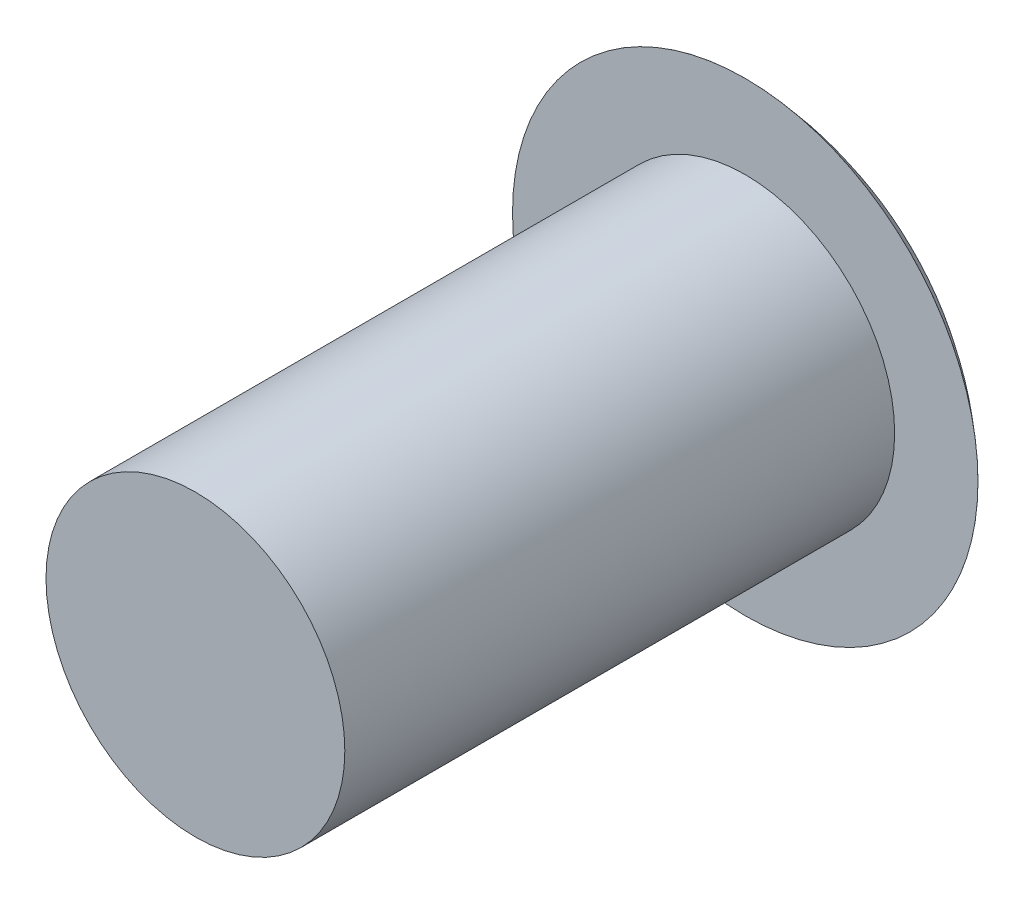
from build123d import *

# Parameters (mm, degrees)
SKETCH1_R           = 5
BOSS_EXTRUDE1_DEPTH = 9.2
SKETCH2_R           = 7.788167924
BOSS_EXTRUDE2_DEPTH = 0.001
DOME1_FACE_RADIUS   = 7.788167924
DOME1_HEIGHT        = 3
CUT_EXTRUDE1_START  = -10
CUT_EXTRUDE1_DEPTH  = 40
CHAMFER2_SIZE       = 0.16446068
SCALE1_SCALE        = 1.9329
SCALE2_SCALE        = 1.5


with BuildPart() as part:
    # Sketch1 → Boss-Extrude1 (new, symmetric)
    with BuildSketch(Plane.XY):
        Circle(SKETCH1_R)
    extrude(amount=BOSS_EXTRUDE1_DEPTH, both=True)

    # Sketch2 → Boss-Extrude2 (add)
    with BuildSketch(Plane(origin=(0, 0, -9.2), x_dir=(-1, 0, 0), z_dir=(0, 0, -1))):
        Circle(SKETCH2_R)
    extrude(amount=BOSS_EXTRUDE2_DEPTH)

    # Dome1: a dome of height H over a round flat face of radius A is a cap of a sphere of radius (A * A + H * H) / (2 * H)
    dome1_r = (DOME1_FACE_RADIUS * DOME1_FACE_RADIUS + DOME1_HEIGHT * DOME1_HEIGHT) / (2 * DOME1_HEIGHT)
    dome1_base = Plane((0, 0, -9.201), z_dir=(0, 0, -1))
    with Locations(dome1_base.offset(DOME1_HEIGHT - dome1_r)):
        dome1_ball = Sphere(dome1_r, mode=Mode.PRIVATE)
    add(split(dome1_ball, bisect_by=dome1_base, keep=Keep.TOP, mode=Mode.PRIVATE))

    # Sketch3 → Cut-Extrude1 (cut)
    with BuildSketch(Plane.XY.offset(CUT_EXTRUDE1_START)):
        Polygon((-3.312540498, 0), (-1.656270249, -2.868744223), (1.656270249, -2.868744223), (3.312540498, 0), (1.656270249, 2.868744223), (-1.656270249, 2.868744223), align=None)
    extrude(amount=-CUT_EXTRUDE1_DEPTH, mode=Mode.SUBTRACT)

    # Chamfer2
    # the kernel refuses this chamfer: 0.2, 0.16446068 mm, written as the material it takes off along each edge
    with BuildSketch(Plane(origin=(-2.484405374, -1.434372111, -0.591740065), x_dir=(-0.09595536386249687, 0.16619956546860265, -0.9814123866061929), z_dir=(-0.49070619330309756, 0.8499280583896772, 0.1919107277249933))) as chamfer2_piece_1_section:
        with BuildLine():
            Line((11.198587704, 0.191737716), (11.2492321 - CHAMFER2_SIZE, 0))
            Line((11.2492321 - CHAMFER2_SIZE, 0), (11.2492321, 0))
            ThreePointArc((11.2492321, 0), (11.223603032, 0.098687532), (11.198587704, 0.191737716))
        make_face()
    chamfer2_piece_1 = revolve(axis=Axis((-2.484405374, -1.434372111, -0.591740065), (-0.866025403784438, -0.5000000000000011, 0)), revolution_arc=22.128626255, mode=Mode.PRIVATE)
    chamfer2_piece_1 = split(chamfer2_piece_1, bisect_by=Plane(origin=(-3.726608061, -0.717186056, -0.591740065), z_dir=(0.8660254037844416, -0.499999999999995, 0)), keep=Keep.TOP, mode=Mode.PRIVATE)
    chamfer2_piece_1 = split(chamfer2_piece_1, bisect_by=Plane(origin=(-2.484405374, -2.868744223, -0.591740065), z_dir=(0, 1, 0)), keep=Keep.TOP, mode=Mode.PRIVATE)
    add(chamfer2_piece_1, mode=Mode.SUBTRACT)
    with BuildSketch(Plane(origin=(0, -2.868744223, -0.591740065), x_dir=(-0.1919107277249941, 0, -0.9814123866061928), z_dir=(-0.9814123866061928, -3.420849025073354e-15, 0.1919107277249941))) as chamfer2_piece_2_section:
        with BuildLine():
            Line((11.198587704, 0.191737716), (11.2492321 - CHAMFER2_SIZE, 0))
            Line((11.2492321 - CHAMFER2_SIZE, 0), (11.2492321, 0))
            ThreePointArc((11.2492321, 0), (11.223603032, 0.098687532), (11.198587704, 0.191737716))
        make_face()
    chamfer2_piece_2 = revolve(axis=Axis((0, -2.868744223, -0.591740065), (0, -1, 0)), revolution_arc=22.128626255, mode=Mode.PRIVATE)
    chamfer2_piece_2 = split(chamfer2_piece_2, bisect_by=Plane(origin=(1.242202687, -3.585930278, -0.591740065), z_dir=(-0.8660254037844415, 0.49999999999999506, 0)), keep=Keep.TOP, mode=Mode.PRIVATE)
    chamfer2_piece_2 = split(chamfer2_piece_2, bisect_by=Plane(origin=(-1.242202687, -3.585930278, -0.591740065), z_dir=(0.866025403784438, 0.5000000000000011, 0)), keep=Keep.TOP, mode=Mode.PRIVATE)
    add(chamfer2_piece_2, mode=Mode.SUBTRACT)
    with BuildSketch(Plane(origin=(2.484405374, -1.434372111, -0.591740065), x_dir=(-0.09595536386249569, -0.16619956546860332, -0.9814123866061929), z_dir=(-0.4907061933030916, -0.8499280583896806, 0.1919107277249933))) as chamfer2_piece_3_section:
        with BuildLine():
            Line((11.198587704, 0.191737716), (11.2492321 - CHAMFER2_SIZE, 0))
            Line((11.2492321 - CHAMFER2_SIZE, 0), (11.2492321, 0))
            ThreePointArc((11.2492321, 0), (11.223603032, 0.098687532), (11.198587704, 0.191737716))
        make_face()
    chamfer2_piece_3 = revolve(axis=Axis((2.484405374, -1.434372111, -0.591740065), (0.8660254037844415, -0.49999999999999506, 0)), revolution_arc=22.128626255, mode=Mode.PRIVATE)
    chamfer2_piece_3 = split(chamfer2_piece_3, bisect_by=Plane(origin=(3.726608061, -0.717186056, -0.591740065), z_dir=(-0.8660254037844346, -0.5000000000000072, 0)), keep=Keep.TOP, mode=Mode.PRIVATE)
    chamfer2_piece_3 = split(chamfer2_piece_3, bisect_by=Plane(origin=(2.484405374, -2.868744223, -0.591740065), z_dir=(0, 1, 0)), keep=Keep.TOP, mode=Mode.PRIVATE)
    add(chamfer2_piece_3, mode=Mode.SUBTRACT)
    with BuildSketch(Plane(origin=(2.484405374, 1.434372111, -0.591740065), x_dir=(0.09595536386249802, -0.16619956546860198, -0.9814123866061929), z_dir=(0.49070619330310355, -0.8499280583896739, 0.19191072772499332))) as chamfer2_piece_4_section:
        with BuildLine():
            Line((11.198587704, 0.191737716), (11.2492321 - CHAMFER2_SIZE, 0))
            Line((11.2492321 - CHAMFER2_SIZE, 0), (11.2492321, 0))
            ThreePointArc((11.2492321, 0), (11.223603032, 0.098687532), (11.198587704, 0.191737716))
        make_face()
    chamfer2_piece_4 = revolve(axis=Axis((2.484405374, 1.434372111, -0.591740065), (0.8660254037844346, 0.5000000000000072, 0)), revolution_arc=22.128626255, mode=Mode.PRIVATE)
    chamfer2_piece_4 = split(chamfer2_piece_4, bisect_by=Plane(origin=(2.484405374, 2.868744223, -0.591740065), z_dir=(0, -1, 0)), keep=Keep.TOP, mode=Mode.PRIVATE)
    chamfer2_piece_4 = split(chamfer2_piece_4, bisect_by=Plane(origin=(3.726608061, 0.717186056, -0.591740065), z_dir=(-0.8660254037844415, 0.49999999999999506, 0)), keep=Keep.TOP, mode=Mode.PRIVATE)
    add(chamfer2_piece_4, mode=Mode.SUBTRACT)
    with BuildSketch(Plane(origin=(0, 2.868744223, -0.591740065), x_dir=(0.1919107277249941, 1.9738645532128006e-15, -0.9814123866061928), z_dir=(0.9814123866061928, 1.0130975958871086e-14, 0.1919107277249941))) as chamfer2_piece_5_section:
        with BuildLine():
            Line((11.198587704, 0.191737716), (11.2492321 - CHAMFER2_SIZE, 0))
            Line((11.2492321 - CHAMFER2_SIZE, 0), (11.2492321, 0))
            ThreePointArc((11.2492321, 0), (11.223603032, 0.098687532), (11.198587704, 0.191737716))
        make_face()
    chamfer2_piece_5 = revolve(axis=Axis((0, 2.868744223, -0.591740065), (0, 1, 0)), revolution_arc=22.128626255, mode=Mode.PRIVATE)
    chamfer2_piece_5 = split(chamfer2_piece_5, bisect_by=Plane(origin=(-1.242202687, 3.585930278, -0.591740065), z_dir=(0.8660254037844416, -0.499999999999995, 0)), keep=Keep.TOP, mode=Mode.PRIVATE)
    chamfer2_piece_5 = split(chamfer2_piece_5, bisect_by=Plane(origin=(1.242202687, 3.585930278, -0.591740065), z_dir=(-0.8660254037844346, -0.5000000000000072, 0)), keep=Keep.TOP, mode=Mode.PRIVATE)
    add(chamfer2_piece_5, mode=Mode.SUBTRACT)
    with BuildSketch(Plane(origin=(-2.484405374, 1.434372111, -0.591740065), x_dir=(0.09595536386249523, 0.16619956546860257, -0.981412386606193), z_dir=(0.4907061933030916, 0.8499280583896808, 0.1919107277249924))) as chamfer2_piece_6_section:
        with BuildLine():
            Line((11.198587704, 0.191737716), (11.2492321 - CHAMFER2_SIZE, 0))
            Line((11.2492321 - CHAMFER2_SIZE, 0), (11.2492321, 0))
            ThreePointArc((11.2492321, 0), (11.223603032, 0.098687532), (11.198587704, 0.191737716))
        make_face()
    chamfer2_piece_6 = revolve(axis=Axis((-2.484405374, 1.434372111, -0.591740065), (-0.8660254037844416, 0.499999999999995, 0)), revolution_arc=22.128626255, mode=Mode.PRIVATE)
    chamfer2_piece_6 = split(chamfer2_piece_6, bisect_by=Plane(origin=(-2.484405374, 2.868744223, -0.591740065), z_dir=(0, -1, 0)), keep=Keep.TOP, mode=Mode.PRIVATE)
    chamfer2_piece_6 = split(chamfer2_piece_6, bisect_by=Plane(origin=(-3.726608061, 0.717186056, -0.591740065), z_dir=(0.866025403784438, 0.5000000000000011, 0)), keep=Keep.TOP, mode=Mode.PRIVATE)
    add(chamfer2_piece_6, mode=Mode.SUBTRACT)
    with BuildSketch(Plane(origin=(-2.484405374, 1.434372111, -0.591740065), x_dir=(0.09595536386249523, 0.16619956546860257, -0.981412386606193), z_dir=(0.4907061933030916, 0.8499280583896808, 0.1919107277249924))) as chamfer2_piece_7a_section:
        with BuildLine():
            Line((11.198587704, 0.191737716), (11.2492321 - CHAMFER2_SIZE, 0))
            Line((11.2492321 - CHAMFER2_SIZE, 0), (11.2492321, 0))
            ThreePointArc((11.2492321, 0), (11.223603032, 0.098687532), (11.198587704, 0.191737716))
        make_face()
    chamfer2_piece_7a = revolve(axis=Axis((-2.484405374, 1.434372111, -0.591740065), (-0.8660254037844416, 0.499999999999995, 0)), revolution_arc=22.128626255, mode=Mode.PRIVATE)
    chamfer2_piece_7a = split(chamfer2_piece_7a, bisect_by=Plane(origin=(-3.726608061, 0.717186056, -0.591740065), z_dir=(-0.866025403784438, -0.5000000000000011, 0)), keep=Keep.TOP, mode=Mode.PRIVATE)
    with BuildSketch(Plane(origin=(-2.484405374, -1.434372111, -0.591740065), x_dir=(-0.09595536386249687, 0.16619956546860265, -0.9814123866061929), z_dir=(-0.49070619330309756, 0.8499280583896772, 0.1919107277249933))) as chamfer2_piece_7b_section:
        with BuildLine():
            Line((11.198587704, 0.191737716), (11.2492321 - CHAMFER2_SIZE, 0))
            Line((11.2492321 - CHAMFER2_SIZE, 0), (11.2492321, 0))
            ThreePointArc((11.2492321, 0), (11.223603032, 0.098687532), (11.198587704, 0.191737716))
        make_face()
    chamfer2_piece_7b = revolve(axis=Axis((-2.484405374, -1.434372111, -0.591740065), (-0.866025403784438, -0.5000000000000011, 0)), revolution_arc=22.128626255, mode=Mode.PRIVATE)
    chamfer2_piece_7b = split(chamfer2_piece_7b, bisect_by=Plane(origin=(-3.726608061, -0.717186056, -0.591740065), z_dir=(-0.8660254037844416, 0.499999999999995, 0)), keep=Keep.TOP, mode=Mode.PRIVATE)
    chamfer2_piece_7 = chamfer2_piece_7a & chamfer2_piece_7b
    add(chamfer2_piece_7, mode=Mode.SUBTRACT)
    with BuildSketch(Plane(origin=(0, -2.868744223, -0.591740065), x_dir=(-0.1919107277249941, 0, -0.9814123866061928), z_dir=(-0.9814123866061928, -3.420849025073354e-15, 0.1919107277249941))) as chamfer2_piece_8a_section:
        with BuildLine():
            Line((11.198587704, 0.191737716), (11.2492321 - CHAMFER2_SIZE, 0))
            Line((11.2492321 - CHAMFER2_SIZE, 0), (11.2492321, 0))
            ThreePointArc((11.2492321, 0), (11.223603032, 0.098687532), (11.198587704, 0.191737716))
        make_face()
    chamfer2_piece_8a = revolve(axis=Axis((0, -2.868744223, -0.591740065), (0, -1, 0)), revolution_arc=22.128626255, mode=Mode.PRIVATE)
    chamfer2_piece_8a = split(chamfer2_piece_8a, bisect_by=Plane(origin=(-1.242202687, -3.585930278, -0.591740065), z_dir=(-0.866025403784438, -0.5000000000000011, 0)), keep=Keep.TOP, mode=Mode.PRIVATE)
    with BuildSketch(Plane(origin=(-2.484405374, -1.434372111, -0.591740065), x_dir=(-0.09595536386249687, 0.16619956546860265, -0.9814123866061929), z_dir=(-0.49070619330309756, 0.8499280583896772, 0.1919107277249933))) as chamfer2_piece_8b_section:
        with BuildLine():
            Line((11.198587704, 0.191737716), (11.2492321 - CHAMFER2_SIZE, 0))
            Line((11.2492321 - CHAMFER2_SIZE, 0), (11.2492321, 0))
            ThreePointArc((11.2492321, 0), (11.223603032, 0.098687532), (11.198587704, 0.191737716))
        make_face()
    chamfer2_piece_8b = revolve(axis=Axis((-2.484405374, -1.434372111, -0.591740065), (-0.866025403784438, -0.5000000000000011, 0)), revolution_arc=22.128626255, mode=Mode.PRIVATE)
    chamfer2_piece_8b = split(chamfer2_piece_8b, bisect_by=Plane(origin=(-2.484405374, -2.868744223, -0.591740065), z_dir=(0, -1, 0)), keep=Keep.TOP, mode=Mode.PRIVATE)
    chamfer2_piece_8 = chamfer2_piece_8a & chamfer2_piece_8b
    add(chamfer2_piece_8, mode=Mode.SUBTRACT)
    with BuildSketch(Plane(origin=(2.484405374, -1.434372111, -0.591740065), x_dir=(-0.09595536386249569, -0.16619956546860332, -0.9814123866061929), z_dir=(-0.4907061933030916, -0.8499280583896806, 0.1919107277249933))) as chamfer2_piece_9a_section:
        with BuildLine():
            Line((11.198587704, 0.191737716), (11.2492321 - CHAMFER2_SIZE, 0))
            Line((11.2492321 - CHAMFER2_SIZE, 0), (11.2492321, 0))
            ThreePointArc((11.2492321, 0), (11.223603032, 0.098687532), (11.198587704, 0.191737716))
        make_face()
    chamfer2_piece_9a = revolve(axis=Axis((2.484405374, -1.434372111, -0.591740065), (0.8660254037844415, -0.49999999999999506, 0)), revolution_arc=22.128626255, mode=Mode.PRIVATE)
    chamfer2_piece_9a = split(chamfer2_piece_9a, bisect_by=Plane(origin=(2.484405374, -2.868744223, -0.591740065), z_dir=(0, -1, 0)), keep=Keep.TOP, mode=Mode.PRIVATE)
    with BuildSketch(Plane(origin=(0, -2.868744223, -0.591740065), x_dir=(-0.1919107277249941, 0, -0.9814123866061928), z_dir=(-0.9814123866061928, -3.420849025073354e-15, 0.1919107277249941))) as chamfer2_piece_9b_section:
        with BuildLine():
            Line((11.198587704, 0.191737716), (11.2492321 - CHAMFER2_SIZE, 0))
            Line((11.2492321 - CHAMFER2_SIZE, 0), (11.2492321, 0))
            ThreePointArc((11.2492321, 0), (11.223603032, 0.098687532), (11.198587704, 0.191737716))
        make_face()
    chamfer2_piece_9b = revolve(axis=Axis((0, -2.868744223, -0.591740065), (0, -1, 0)), revolution_arc=22.128626255, mode=Mode.PRIVATE)
    chamfer2_piece_9b = split(chamfer2_piece_9b, bisect_by=Plane(origin=(1.242202687, -3.585930278, -0.591740065), z_dir=(0.8660254037844415, -0.49999999999999506, 0)), keep=Keep.TOP, mode=Mode.PRIVATE)
    chamfer2_piece_9 = chamfer2_piece_9a & chamfer2_piece_9b
    add(chamfer2_piece_9, mode=Mode.SUBTRACT)
    with BuildSketch(Plane(origin=(2.484405374, 1.434372111, -0.591740065), x_dir=(0.09595536386249802, -0.16619956546860198, -0.9814123866061929), z_dir=(0.49070619330310355, -0.8499280583896739, 0.19191072772499332))) as chamfer2_piece_10a_section:
        with BuildLine():
            Line((11.198587704, 0.191737716), (11.2492321 - CHAMFER2_SIZE, 0))
            Line((11.2492321 - CHAMFER2_SIZE, 0), (11.2492321, 0))
            ThreePointArc((11.2492321, 0), (11.223603032, 0.098687532), (11.198587704, 0.191737716))
        make_face()
    chamfer2_piece_10a = revolve(axis=Axis((2.484405374, 1.434372111, -0.591740065), (0.8660254037844346, 0.5000000000000072, 0)), revolution_arc=22.128626255, mode=Mode.PRIVATE)
    chamfer2_piece_10a = split(chamfer2_piece_10a, bisect_by=Plane(origin=(3.726608061, 0.717186056, -0.591740065), z_dir=(0.8660254037844415, -0.49999999999999506, 0)), keep=Keep.TOP, mode=Mode.PRIVATE)
    with BuildSketch(Plane(origin=(2.484405374, -1.434372111, -0.591740065), x_dir=(-0.09595536386249569, -0.16619956546860332, -0.9814123866061929), z_dir=(-0.4907061933030916, -0.8499280583896806, 0.1919107277249933))) as chamfer2_piece_10b_section:
        with BuildLine():
            Line((11.198587704, 0.191737716), (11.2492321 - CHAMFER2_SIZE, 0))
            Line((11.2492321 - CHAMFER2_SIZE, 0), (11.2492321, 0))
            ThreePointArc((11.2492321, 0), (11.223603032, 0.098687532), (11.198587704, 0.191737716))
        make_face()
    chamfer2_piece_10b = revolve(axis=Axis((2.484405374, -1.434372111, -0.591740065), (0.8660254037844415, -0.49999999999999506, 0)), revolution_arc=22.128626255, mode=Mode.PRIVATE)
    chamfer2_piece_10b = split(chamfer2_piece_10b, bisect_by=Plane(origin=(3.726608061, -0.717186056, -0.591740065), z_dir=(0.8660254037844346, 0.5000000000000072, 0)), keep=Keep.TOP, mode=Mode.PRIVATE)
    chamfer2_piece_10 = chamfer2_piece_10a & chamfer2_piece_10b
    add(chamfer2_piece_10, mode=Mode.SUBTRACT)
    with BuildSketch(Plane(origin=(0, 2.868744223, -0.591740065), x_dir=(0.1919107277249941, 1.9738645532128006e-15, -0.9814123866061928), z_dir=(0.9814123866061928, 1.0130975958871086e-14, 0.1919107277249941))) as chamfer2_piece_11a_section:
        with BuildLine():
            Line((11.198587704, 0.191737716), (11.2492321 - CHAMFER2_SIZE, 0))
            Line((11.2492321 - CHAMFER2_SIZE, 0), (11.2492321, 0))
            ThreePointArc((11.2492321, 0), (11.223603032, 0.098687532), (11.198587704, 0.191737716))
        make_face()
    chamfer2_piece_11a = revolve(axis=Axis((0, 2.868744223, -0.591740065), (0, 1, 0)), revolution_arc=22.128626255, mode=Mode.PRIVATE)
    chamfer2_piece_11a = split(chamfer2_piece_11a, bisect_by=Plane(origin=(1.242202687, 3.585930278, -0.591740065), z_dir=(0.8660254037844346, 0.5000000000000072, 0)), keep=Keep.TOP, mode=Mode.PRIVATE)
    with BuildSketch(Plane(origin=(2.484405374, 1.434372111, -0.591740065), x_dir=(0.09595536386249802, -0.16619956546860198, -0.9814123866061929), z_dir=(0.49070619330310355, -0.8499280583896739, 0.19191072772499332))) as chamfer2_piece_11b_section:
        with BuildLine():
            Line((11.198587704, 0.191737716), (11.2492321 - CHAMFER2_SIZE, 0))
            Line((11.2492321 - CHAMFER2_SIZE, 0), (11.2492321, 0))
            ThreePointArc((11.2492321, 0), (11.223603032, 0.098687532), (11.198587704, 0.191737716))
        make_face()
    chamfer2_piece_11b = revolve(axis=Axis((2.484405374, 1.434372111, -0.591740065), (0.8660254037844346, 0.5000000000000072, 0)), revolution_arc=22.128626255, mode=Mode.PRIVATE)
    chamfer2_piece_11b = split(chamfer2_piece_11b, bisect_by=Plane(origin=(2.484405374, 2.868744223, -0.591740065), z_dir=(0, 1, 0)), keep=Keep.TOP, mode=Mode.PRIVATE)
    chamfer2_piece_11 = chamfer2_piece_11a & chamfer2_piece_11b
    add(chamfer2_piece_11, mode=Mode.SUBTRACT)
    with BuildSketch(Plane(origin=(-2.484405374, 1.434372111, -0.591740065), x_dir=(0.09595536386249523, 0.16619956546860257, -0.981412386606193), z_dir=(0.4907061933030916, 0.8499280583896808, 0.1919107277249924))) as chamfer2_piece_12a_section:
        with BuildLine():
            Line((11.198587704, 0.191737716), (11.2492321 - CHAMFER2_SIZE, 0))
            Line((11.2492321 - CHAMFER2_SIZE, 0), (11.2492321, 0))
            ThreePointArc((11.2492321, 0), (11.223603032, 0.098687532), (11.198587704, 0.191737716))
        make_face()
    chamfer2_piece_12a = revolve(axis=Axis((-2.484405374, 1.434372111, -0.591740065), (-0.8660254037844416, 0.499999999999995, 0)), revolution_arc=22.128626255, mode=Mode.PRIVATE)
    chamfer2_piece_12a = split(chamfer2_piece_12a, bisect_by=Plane(origin=(-2.484405374, 2.868744223, -0.591740065), z_dir=(0, 1, 0)), keep=Keep.TOP, mode=Mode.PRIVATE)
    with BuildSketch(Plane(origin=(0, 2.868744223, -0.591740065), x_dir=(0.1919107277249941, 1.9738645532128006e-15, -0.9814123866061928), z_dir=(0.9814123866061928, 1.0130975958871086e-14, 0.1919107277249941))) as chamfer2_piece_12b_section:
        with BuildLine():
            Line((11.198587704, 0.191737716), (11.2492321 - CHAMFER2_SIZE, 0))
            Line((11.2492321 - CHAMFER2_SIZE, 0), (11.2492321, 0))
            ThreePointArc((11.2492321, 0), (11.223603032, 0.098687532), (11.198587704, 0.191737716))
        make_face()
    chamfer2_piece_12b = revolve(axis=Axis((0, 2.868744223, -0.591740065), (0, 1, 0)), revolution_arc=22.128626255, mode=Mode.PRIVATE)
    chamfer2_piece_12b = split(chamfer2_piece_12b, bisect_by=Plane(origin=(-1.242202687, 3.585930278, -0.591740065), z_dir=(-0.8660254037844416, 0.499999999999995, 0)), keep=Keep.TOP, mode=Mode.PRIVATE)
    chamfer2_piece_12 = chamfer2_piece_12a & chamfer2_piece_12b
    add(chamfer2_piece_12, mode=Mode.SUBTRACT)


with BuildPart() as part_1:
    # Scale1: scaled about (0, 0, -1.443824767)
    add(part.part.scale(SCALE1_SCALE).moved(Location((0, 0, 1.346944125))))


with BuildPart() as part_2:
    # Scale2: scaled about (0, 0, -1.443824767)
    add(part_1.part.scale(SCALE2_SCALE).moved(Location((0, 0, 0.721912383))))


solid = part_2.part
